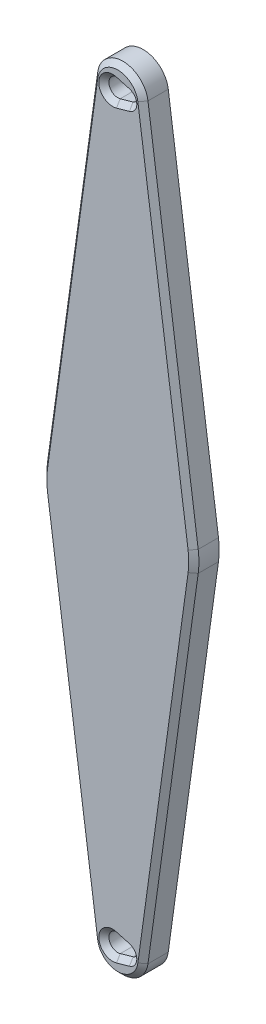
from build123d import *

# Parameters (mm, degrees)
BOSS_EXTRUDE1_DEPTH      = 5
CHAMFER1_SIZE            = 1
CUT_EXTRUDE2_REACH       = 179.034
CHAMFER3_SIZE            = 1
CHAMFER3_OF_MIRROR2_SIZE = 1


with BuildPart() as part:
    # Sketch1 → Boss-Extrude1 (new body)
    with BuildSketch(Plane.XY):
        with BuildLine():
            ThreePointArc((99.858594129, 65.945205479), (100, 68), (99.858594129, 70.054794521))
            Line((99.858594129, 70.054794521), (89.95286471, 141.684931507))
            ThreePointArc((89.95286471, 141.684931507), (85, 146), (80.04713529, 141.684931507))
            Line((80.04713529, 141.684931507), (70.141405871, 70.054794521))
            ThreePointArc((70.141405871, 70.054794521), (70, 68), (70.141405871, 65.945205479))
            Line((70.141405871, 65.945205479), (80.04713529, -5.684931507))
            ThreePointArc((80.04713529, -5.684931507), (85, -10), (89.95286471, -5.684931507))
            Line((89.95286471, -5.684931507), (99.858594129, 65.945205479))
        make_face()
    extrude(amount=BOSS_EXTRUDE1_DEPTH)

    # Chamfer1
    chamfer1_edges = [part.edges().sort_by_distance(p)[0] for p in [
        (75.094270581, 30.130136986, 5),
        (70, 68, 5),
        (75.094270581, 105.869863014, 5),
        (85, 146, 5),
        (94.905729419, 105.869863014, 5),
        (100, 68, 5),
        (94.905729419, 30.130136986, 5),
        (85, -10, 5),
    ]]
    chamfer(chamfer1_edges, length=CHAMFER1_SIZE)

    # Sketch6 → Cut-Extrude2 (cut, up to next)
    with BuildSketch(Plane.XY.offset(5), mode=Mode.PRIVATE) as cut_extrude2_sk1:
        with BuildLine():
            Line((84.477272727, 139.316340075), (87.022727273, 140.037908614))
            ThreePointArc((87.022727273, 140.037908614), (87.75, 141), (87.022727273, 141.962091386))
            Line((87.022727273, 141.962091386), (84.477272727, 142.683659925))
            ThreePointArc((84.477272727, 142.683659925), (82.25, 141), (84.477272727, 139.316340075))
        make_face()
    cut_extrude2_tool1 = extrude(cut_extrude2_sk1.sketch, amount=-CUT_EXTRUDE2_REACH, mode=Mode.PRIVATE) & part.part
    cut_extrude2 = cut_extrude2_tool1.solids().sort_by_distance((84.791234, 141, 5))[0]
    add(cut_extrude2, mode=Mode.SUBTRACT)

    # Chamfer3
    chamfer3_edges = [part.edges().sort_by_distance(p)[0] for p in [
        (85.75, 139.677124344, 0),
        (87.75, 141, 0),
        (82.25, 141, 0),
        (85.75, 142.322875656, 0),
        (87.75, 141, 5),
        (85.75, 139.677124344, 5),
        (82.25, 141, 5),
        (85.75, 142.322875656, 5),
    ]]
    chamfer(chamfer3_edges, length=CHAMFER3_SIZE)

    # Mirror2: Cut-Extrude2 across plane
    add(cut_extrude2.mirror(Plane(origin=(0, 68, 0), x_dir=(0, 0, 1), z_dir=(0, -1, 0))), mode=Mode.SUBTRACT)

    # Chamfer3 of Mirror2
    chamfer3_of_mirror2_edges = [part.edges().sort_by_distance(p)[0] for p in [
        (85.75, -3.677124344, 0),
        (87.75, -5, 0),
        (82.25, -5, 0),
        (85.75, -6.322875656, 0),
        (87.75, -5, 5),
        (85.75, -3.677124344, 5),
        (82.25, -5, 5),
        (85.75, -6.322875656, 5),
    ]]
    chamfer(chamfer3_of_mirror2_edges, length=CHAMFER3_OF_MIRROR2_SIZE)


solid = part.part
